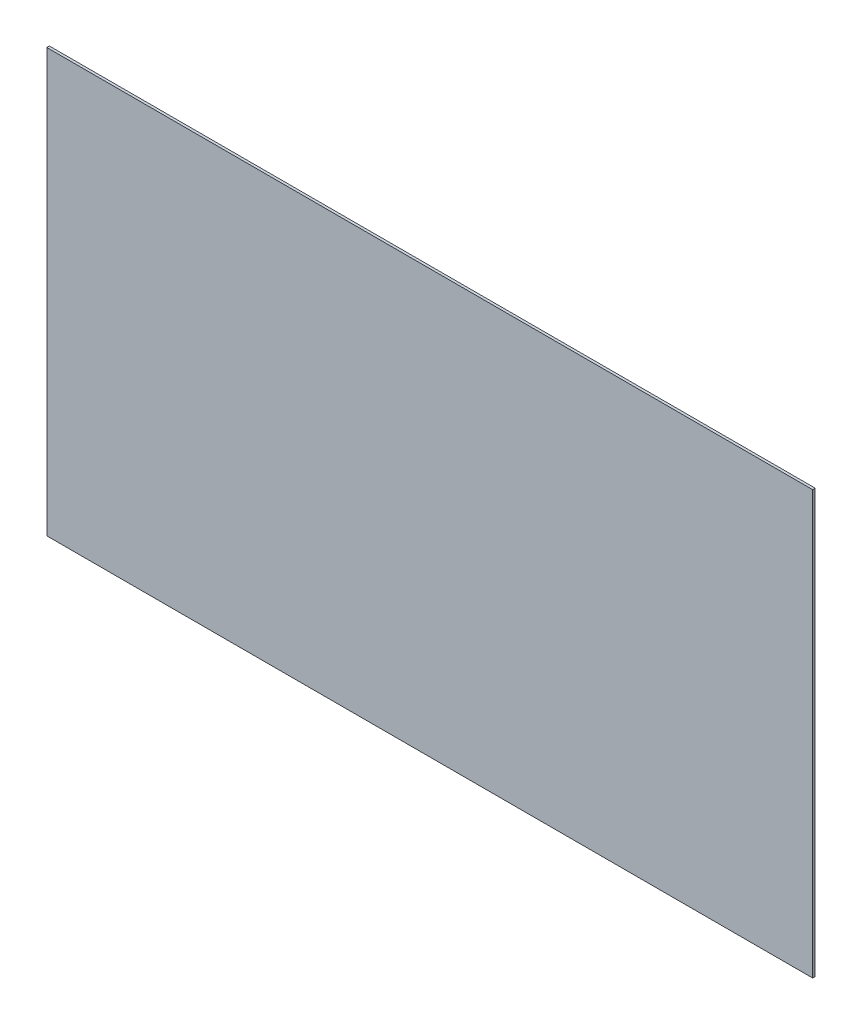
from build123d import *

# Parameters (mm, degrees)
SKETCH2_W           = 600.8
SKETCH2_H           = 331.82
BOSS_EXTRUDE1_DEPTH = 2.032


with BuildPart() as part:
    # Sketch2 → Boss-Extrude1 (new body)
    with BuildSketch(Plane.XY):
        Rectangle(SKETCH2_W, SKETCH2_H)
    extrude(amount=BOSS_EXTRUDE1_DEPTH)


solid = part.part
